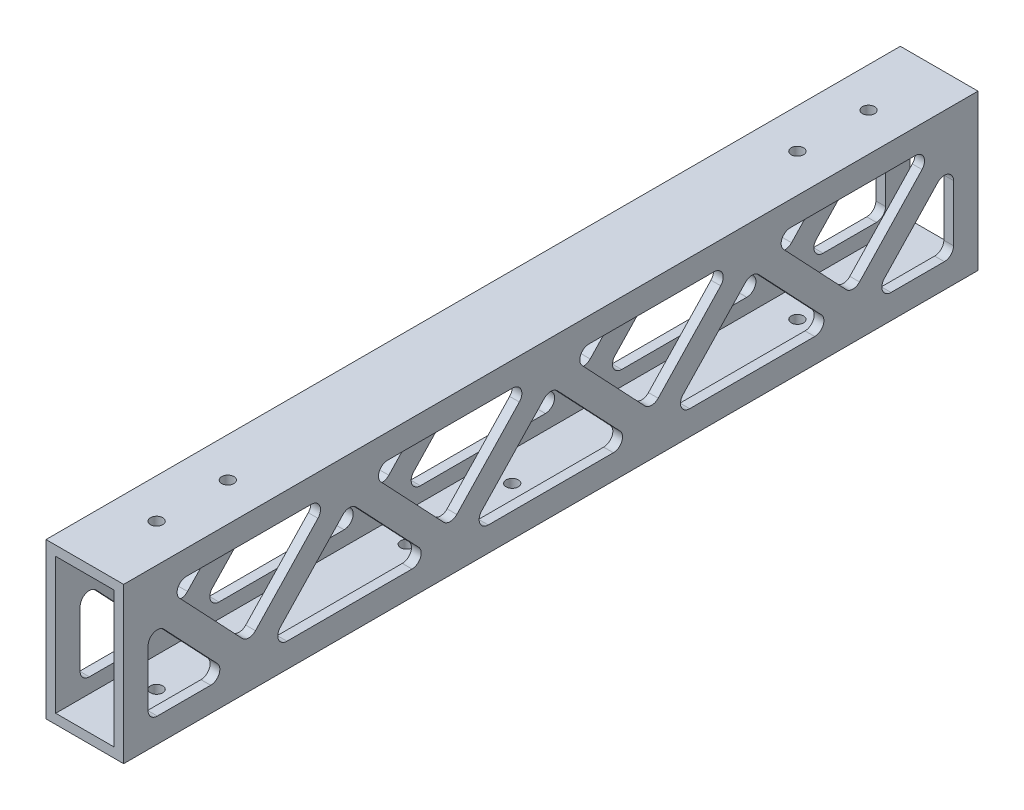
from build123d import *

# Parameters (mm, degrees)
SKETCH1_W           = 25.4
SKETCH1_H           = 50.8
SKETCH1_W_2         = 19.05
SKETCH1_H_2         = 44.45
BOSS_EXTRUDE1_DEPTH = 279.4
CUT_EXTRUDE1_DEPTH  = 282.699627263
FILLET1_R           = 3
MIRROR2_START       = -12.7
MIRROR2_DEPTH       = 3.175
SKETCH4_R           = 2
CUT_EXTRUDE2_DEPTH  = 285.264471927
SKETCH5_R           = 2
CUT_EXTRUDE3_DEPTH  = 10


# Read off the part's stored shape, not the designer's step: Mirror2
with BuildPart() as part:
    # Sketch1 → Boss-Extrude1 (new body)
    with BuildSketch(Plane.XY):
        Rectangle(SKETCH1_W, SKETCH1_H)
        Rectangle(SKETCH1_W_2, SKETCH1_H_2, mode=Mode.SUBTRACT)
    extrude(amount=BOSS_EXTRUDE1_DEPTH)

    # Sketch3 → Cut-Extrude1 (cut, through all)
    with BuildSketch(Plane(origin=(12.7, 0, 0), x_dir=(0, 0, -1), z_dir=(1, 0, 0))):
        Polygon((-271.4, -17.4), (-243.98156969, -17.4), (-271.4, 11.579844337), align=None)
        Polygon((-238.475, -11.579844337), (-211.05656969, 17.4), (-265.89343031, 17.4), align=None)
        Polygon((-232.96843031, -17.4), (-178.13156969, -17.4), (-205.55, 11.579844337), align=None)
        Polygon((-172.625, -11.579844337), (-145.20656969, 17.4), (-200.04343031, 17.4), align=None)
        Polygon((-139.7, -17.4), (-139.7, 11.579844337), (-167.11843031, -17.4), align=None)
        Polygon((-139.7, -17.4), (-112.28156969, -17.4), (-139.7, 11.579844337), align=None)
        Polygon((-79.35656969, 17.4), (-134.19343031, 17.4), (-106.775, -11.579844337), align=None)
        Polygon((-73.85, 11.579844337), (-101.26843031, -17.4), (-46.43156969, -17.4), align=None)
        Polygon((-13.50656969, 17.4), (-68.34343031, 17.4), (-40.925, -11.579844337), align=None)
        Polygon((-8, 11.579844337), (-35.41843031, -17.4), (-8, -17.4), align=None)
    extrude(amount=-CUT_EXTRUDE1_DEPTH, mode=Mode.SUBTRACT)

    # Fillet1
    fillet1_edges = [part.edges().sort_by_distance(p)[0] for p in [
        (11.1125, -17.4, 167.11843031),
        (11.1125, 11.579844337, 139.7),
        (11.1125, -17.4, 112.28156969),
        (11.1125, -11.579844337, 238.475),
        (11.1125, 17.4, 265.89343031),
        (11.1125, 17.4, 211.05656969),
        (11.1125, 11.579844337, 205.55),
        (11.1125, -17.4, 178.13156969),
        (11.1125, -17.4, 232.96843031),
        (11.1125, 17.4, 13.50656969),
        (11.1125, -11.579844337, 40.925),
        (11.1125, 17.4, 68.34343031),
        (11.1125, 11.579844337, 8),
        (11.1125, -17.4, 8),
        (11.1125, -17.4, 35.41843031),
        (11.1125, 17.4, 79.35656969),
        (11.1125, -11.579844337, 106.775),
        (11.1125, 17.4, 134.19343031),
        (11.1125, -17.4, 46.43156969),
        (11.1125, -17.4, 101.26843031),
        (11.1125, 11.579844337, 73.85),
        (11.1125, 11.579844337, 271.4),
        (11.1125, -17.4, 243.98156969),
        (11.1125, -17.4, 271.4),
        (11.1125, -11.579844337, 172.625),
        (11.1125, 17.4, 200.04343031),
        (11.1125, 17.4, 145.20656969),
    ]]
    fillet(fillet1_edges, radius=FILLET1_R)

    # Mirror2 outline → Mirror2 (add)
    with BuildSketch(Plane.YZ.offset(MIRROR2_START)):
        with BuildLine():
            Line((-17.4, 35.41843031), (-17.4, 28.450140974))
            ThreePointArc((-17.4, 28.450140974), (-15.586296427, 31.205626555), (-12.338199475, 30.629356107))
            Line((-12.338199475, 30.629356107), (-17.4, 35.41843031))
        make_face()
        with BuildLine():
            ThreePointArc((-14.4, 8), (-16.521320344, 8.878679656), (-17.4, 11))
            Line((-17.4, 11), (-17.4, 8))
            Line((-17.4, 8), (-14.4, 8))
        make_face()
        with BuildLine():
            Line((11.579844337, 8), (6.105685289, 13.179215133))
            ThreePointArc((6.105685289, 13.179215133), (6.831145553, 9.890415708), (4.043884765, 8))
            Line((4.043884765, 8), (11.579844337, 8))
        make_face()
        with BuildLine():
            ThreePointArc((17.4, 20.474859026), (15.586296427, 17.719373445), (12.338199475, 18.295643893))
            Line((12.338199475, 18.295643893), (17.4, 13.50656969))
            Line((17.4, 13.50656969), (17.4, 20.474859026))
        make_face()
        with BuildLine():
            Line((-11.579844337, 40.925), (-9.276528114, 38.745784867))
            ThreePointArc((-9.276528114, 38.745784867), (-10.214727589, 40.925), (-9.276528114, 43.104215133))
            Line((-9.276528114, 43.104215133), (-11.579844337, 40.925))
        make_face()
        with BuildLine():
            ThreePointArc((12.338199475, 63.554356107), (15.586296427, 64.130626555), (17.4, 61.375140974))
            Line((17.4, 61.375140974), (17.4, 68.34343031))
            Line((17.4, 68.34343031), (12.338199475, 63.554356107))
        make_face()
        with BuildLine():
            Line((-17.4, 101.26843031), (-17.4, 94.300140974))
            ThreePointArc((-17.4, 94.300140974), (-15.586296427, 97.055626555), (-12.338199475, 96.479356107))
            Line((-12.338199475, 96.479356107), (-17.4, 101.26843031))
        make_face()
        with BuildLine():
            ThreePointArc((-12.338199475, 51.220643893), (-15.586296427, 50.644373445), (-17.4, 53.399859026))
            Line((-17.4, 53.399859026), (-17.4, 46.43156969))
            Line((-17.4, 46.43156969), (-12.338199475, 51.220643893))
        make_face()
        with BuildLine():
            Line((11.579844337, 73.85), (9.276528114, 76.029215133))
            ThreePointArc((9.276528114, 76.029215133), (10.214727589, 73.85), (9.276528114, 71.670784867))
            Line((9.276528114, 71.670784867), (11.579844337, 73.85))
        make_face()
        with BuildLine():
            Line((-11.579844337, 106.775), (-9.276528114, 104.595784867))
            ThreePointArc((-9.276528114, 104.595784867), (-10.214727589, 106.775), (-9.276528114, 108.954215133))
            Line((-9.276528114, 108.954215133), (-11.579844337, 106.775))
        make_face()
        with BuildLine():
            ThreePointArc((17.4, 86.324859026), (15.586296427, 83.569373445), (12.338199475, 84.145643893))
            Line((12.338199475, 84.145643893), (17.4, 79.35656969))
            Line((17.4, 79.35656969), (17.4, 86.324859026))
        make_face()
        with BuildLine():
            Line((17.4, 134.19343031), (12.338199475, 129.404356107))
            ThreePointArc((12.338199475, 129.404356107), (15.586296427, 129.980626555), (17.4, 127.225140974))
            Line((17.4, 127.225140974), (17.4, 134.19343031))
        make_face()
        with BuildLine():
            Line((-17.4, 112.28156969), (-12.338199475, 117.070643893))
            ThreePointArc((-12.338199475, 117.070643893), (-15.586296427, 116.494373445), (-17.4, 119.249859026))
            Line((-17.4, 119.249859026), (-17.4, 112.28156969))
        make_face()
        with BuildLine():
            ThreePointArc((9.276528114, 141.879215133), (10.214727589, 139.7), (9.276528114, 137.520784867))
            Line((9.276528114, 137.520784867), (11.579844337, 139.7))
            Line((11.579844337, 139.7), (9.276528114, 141.879215133))
        make_face()
        with BuildLine():
            Line((-17.4, 167.11843031), (-17.4, 160.150140974))
            ThreePointArc((-17.4, 160.150140974), (-15.586296427, 162.905626555), (-12.338199475, 162.329356107))
            Line((-12.338199475, 162.329356107), (-17.4, 167.11843031))
        make_face()
        with BuildLine():
            Line((17.4, 145.20656969), (17.4, 152.174859026))
            ThreePointArc((17.4, 152.174859026), (15.586296427, 149.419373445), (12.338199475, 149.995643893))
            Line((12.338199475, 149.995643893), (17.4, 145.20656969))
        make_face()
        with BuildLine():
            ThreePointArc((12.338199475, 195.254356107), (15.586296427, 195.830626555), (17.4, 193.075140974))
            Line((17.4, 193.075140974), (17.4, 200.04343031))
            Line((17.4, 200.04343031), (12.338199475, 195.254356107))
        make_face()
        with BuildLine():
            Line((-11.579844337, 172.625), (-9.276528114, 170.445784867))
            ThreePointArc((-9.276528114, 170.445784867), (-10.214727589, 172.625), (-9.276528114, 174.804215133))
            Line((-9.276528114, 174.804215133), (-11.579844337, 172.625))
        make_face()
        with BuildLine():
            ThreePointArc((-12.338199475, 182.920643893), (-15.586296427, 182.344373445), (-17.4, 185.099859026))
            Line((-17.4, 185.099859026), (-17.4, 178.13156969))
            Line((-17.4, 178.13156969), (-12.338199475, 182.920643893))
        make_face()
        with BuildLine():
            Line((-17.4, 232.96843031), (-17.4, 226.000140974))
            ThreePointArc((-17.4, 226.000140974), (-15.586296427, 228.755626555), (-12.338199475, 228.179356107))
            Line((-12.338199475, 228.179356107), (-17.4, 232.96843031))
        make_face()
        with BuildLine():
            ThreePointArc((9.276528114, 207.729215133), (10.214727589, 205.55), (9.276528114, 203.370784867))
            Line((9.276528114, 203.370784867), (11.579844337, 205.55))
            Line((11.579844337, 205.55), (9.276528114, 207.729215133))
        make_face()
        with BuildLine():
            Line((-11.579844337, 238.475), (-9.276528114, 236.295784867))
            ThreePointArc((-9.276528114, 236.295784867), (-10.214727589, 238.475), (-9.276528114, 240.654215133))
            Line((-9.276528114, 240.654215133), (-11.579844337, 238.475))
        make_face()
        with BuildLine():
            ThreePointArc((17.4, 218.024859026), (15.586296427, 215.269373445), (12.338199475, 215.845643893))
            Line((12.338199475, 215.845643893), (17.4, 211.05656969))
            Line((17.4, 211.05656969), (17.4, 218.024859026))
        make_face()
        with BuildLine():
            Line((17.4, 265.89343031), (12.338199475, 261.104356107))
            ThreePointArc((12.338199475, 261.104356107), (15.586296427, 261.680626555), (17.4, 258.925140974))
            Line((17.4, 258.925140974), (17.4, 265.89343031))
        make_face()
        with BuildLine():
            ThreePointArc((-12.338199475, 248.770643893), (-15.586296427, 248.194373445), (-17.4, 250.949859026))
            Line((-17.4, 250.949859026), (-17.4, 243.98156969))
            Line((-17.4, 243.98156969), (-12.338199475, 248.770643893))
        make_face()
        with BuildLine():
            Line((-17.4, 271.4), (-17.4, 268.4))
            ThreePointArc((-17.4, 268.4), (-16.521320344, 270.521320344), (-14.4, 271.4))
            Line((-14.4, 271.4), (-17.4, 271.4))
        make_face()
        with BuildLine():
            ThreePointArc((4.043884765, 271.4), (6.831145553, 269.509584292), (6.105685289, 266.220784867))
            Line((6.105685289, 266.220784867), (11.579844337, 271.4))
            Line((11.579844337, 271.4), (4.043884765, 271.4))
        make_face()
    extrude(amount=MIRROR2_DEPTH)

    # Sketch4 → Cut-Extrude2 (cut, through all)
    with BuildSketch(Plane(origin=(0, 25.4, 0), x_dir=(1, 0, 0), z_dir=(0, 1, 0))):
        with Locations(Location((0.194187774, -256.116666667, 0), (0, 0, 270))):
            Circle(SKETCH4_R)
        with Locations(Location((0.194187774, -232.833333333, 0), (0, 0, 270))):
            Circle(SKETCH4_R)
        with Locations(Location((0.194187774, -23.283333333, 0), (0, 0, 270))):
            Circle(SKETCH4_R)
        with Locations(Location((0.194187774, -46.566666667, 0), (0, 0, 270))):
            Circle(SKETCH4_R)
    extrude(amount=-CUT_EXTRUDE2_DEPTH, mode=Mode.SUBTRACT)

    # Sketch5 → Cut-Extrude3 (cut)
    with BuildSketch(Plane.XZ.offset(25.4)):
        with Locations((0, 174.130820965)):
            Circle(SKETCH5_R)
        with Locations((0, 139.627653329)):
            Circle(SKETCH5_R)
        with Locations((0, 105.124485692)):
            Circle(SKETCH5_R)
    extrude(amount=-CUT_EXTRUDE3_DEPTH, mode=Mode.SUBTRACT)


solid = part.part
